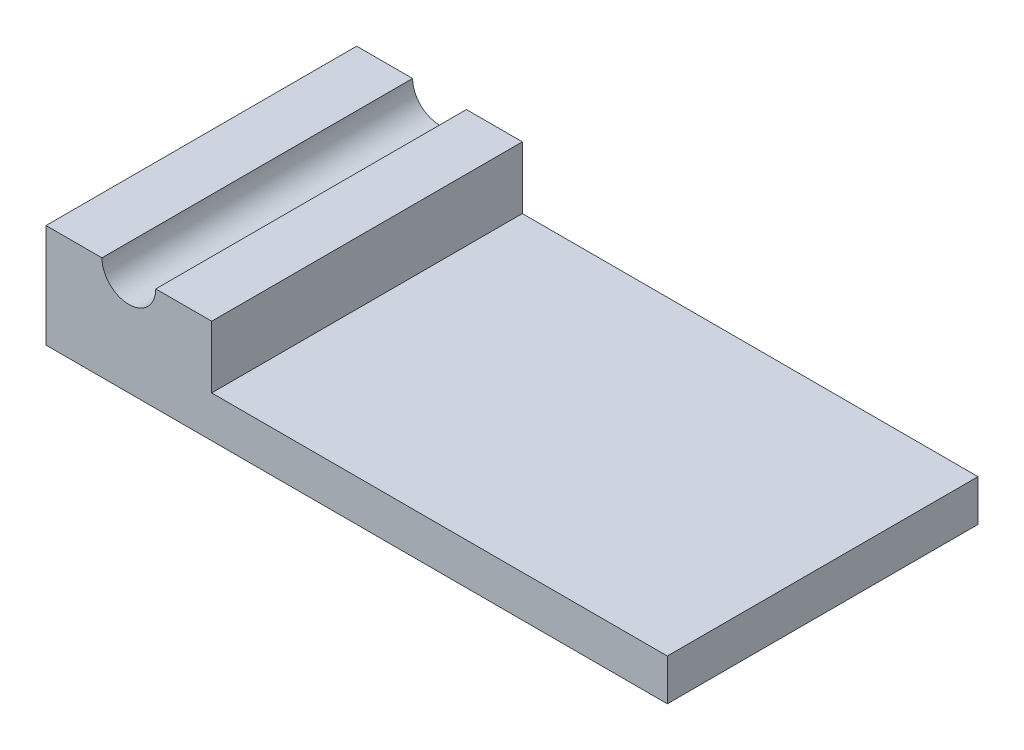
from build123d import *

# Parameters (mm, degrees)
BOSS_EXTRUDE1_DEPTH = 15
SKETCH3_R           = 1.75
CUT_EXTRUDE1_DEPTH  = 1
CHAMFER1_SIZE       = 0.5


with BuildPart() as part:
    # Sketch2 → Boss-Extrude1 (new body)
    with BuildSketch(Plane.XY):
        with BuildLine():
            Line((0, 0), (0, 5))
            Line((0, 5), (2.7, 5))
            ThreePointArc((2.7, 5), (4, 3.7), (5.3, 5))
            Line((5.3, 5), (8, 5))
            Line((8, 5), (8, 2))
            Line((8, 2), (30, 2))
            Line((30, 2), (30, 0))
            Line((30, 0), (0, 0))
        make_face()
    extrude(amount=BOSS_EXTRUDE1_DEPTH)

    # Sketch3 → Cut-Extrude1 (cut)
    with BuildSketch(Plane.XZ):
        with Locations(Location((15, 7.5, 0), (0, 0, 270))):
            Circle(SKETCH3_R)
    extrude(amount=-CUT_EXTRUDE1_DEPTH, mode=Mode.SUBTRACT)

    # Chamfer1
    chamfer1_edges = [part.edges().sort_by_distance(p)[0] for p in [
        (15, 1, 9.25),
        (15, 0, 9.25),
    ]]
    chamfer(chamfer1_edges, length=CHAMFER1_SIZE - 0.0001)  # a hair under: the kernel refuses the full size


solid = part.part
